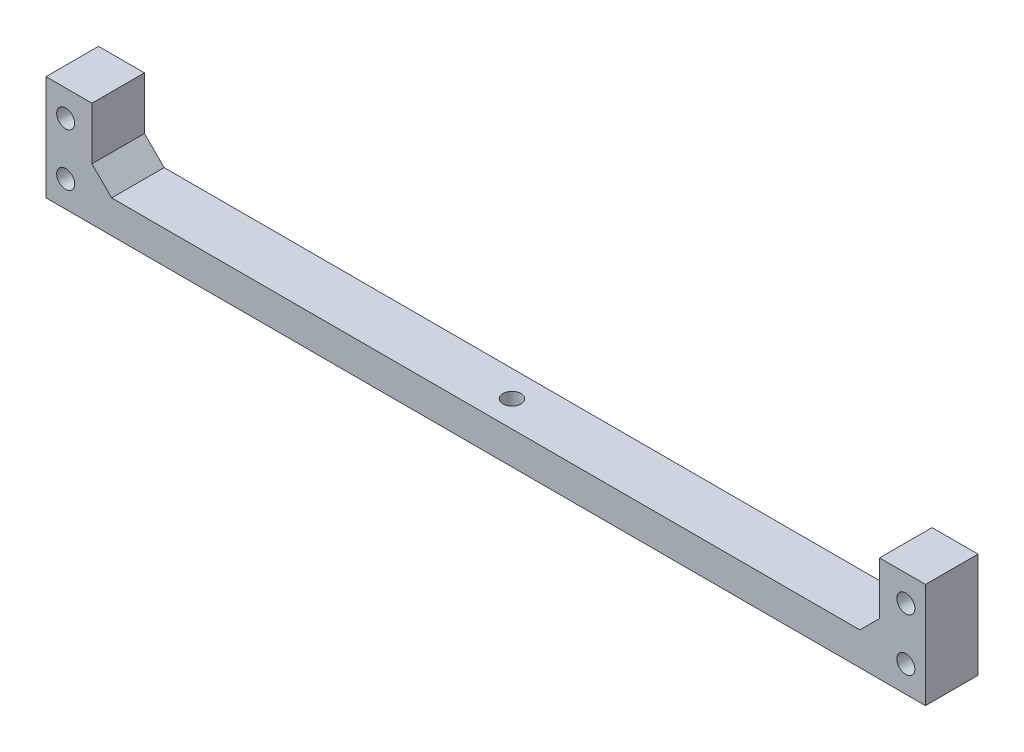
from build123d import *

# Parameters (mm, degrees)
SKETCH1_W               = 215.9
SKETCH1_H               = 12.7
BOSS_EXTRUDE1_DEPTH     = 6.35
CUT_EXTRUDE2_DEPTH      = 109.879819067
CUT_EXTRUDE2_DEPTH_BACK = 109.879819067
CUT_EXTRUDE3_DEPTH      = 110.433918417
CUT_EXTRUDE3_DEPTH_BACK = 110.433918417
SKETCH4_R               = 2.1828125
SKETCH5_W               = 12.7
SKETCH5_H               = 12.7
BOSS_EXTRUDE2_DEPTH     = 12.7
CUT_EXTRUDE1_DEPTH      = 111.351234701
CUT_EXTRUDE1_DEPTH_BACK = 111.351234701
SKETCH2_R               = 2.1828125
SKETCH2_W               = 1.5875
SKETCH2_H               = 25.4


with BuildPart() as part:
    # Sketch1 → Boss-Extrude1 (new, symmetric)
    with BuildSketch(Plane(origin=(0, 0, 0), x_dir=(1, 0, 0), z_dir=(0, 1, 0))):
        with Locations((0, 6.35)):
            Rectangle(SKETCH1_W, SKETCH1_H)
    extrude(amount=BOSS_EXTRUDE1_DEPTH, both=True)

    # Sketch3 → Cut-Extrude2 (cut, two sides: drawn at the far end of the back side and taken through both)
    with BuildSketch(Plane.XY.offset(-CUT_EXTRUDE2_DEPTH_BACK)):
        Polygon((-95.25, 6.35), (-90.4875, 1.5875), (90.4875, 1.5875), (95.25, 6.35), align=None)
    extrude(amount=CUT_EXTRUDE2_DEPTH + CUT_EXTRUDE2_DEPTH_BACK, mode=Mode.SUBTRACT)

    # Sketch4 → Cut-Extrude3 (cut, two sides: drawn at the far end of the back side and taken through both)
    with BuildSketch(Plane.XZ.offset(6.35).offset(-CUT_EXTRUDE3_DEPTH_BACK)):
        with Locations((0, -6.35)):
            Circle(SKETCH4_R)
    extrude(amount=CUT_EXTRUDE3_DEPTH + CUT_EXTRUDE3_DEPTH_BACK, mode=Mode.SUBTRACT)

    # Sketch5 → Boss-Extrude2 (add)
    with BuildSketch(Plane(origin=(0, 6.35, 0), x_dir=(1, 0, 0), z_dir=(0, 1, 0))):
        with Locations((-101.6, 6.35)):
            Rectangle(SKETCH5_W, SKETCH5_H)
        with Locations((101.6, 6.35)):
            Rectangle(SKETCH5_W, SKETCH5_H)
    extrude(amount=BOSS_EXTRUDE2_DEPTH)

    # Sketch2 → Cut-Extrude1 (cut, two sides: drawn at the far end of the back side and taken through both)
    with BuildSketch(Plane.XY.offset(-CUT_EXTRUDE1_DEPTH_BACK)):
        with Locations((-101.6, 0)):
            Circle(SKETCH2_R)
        with Locations((101.6, 0)):
            Circle(SKETCH2_R)
        with Locations((-101.6, 12.7)):
            Circle(SKETCH2_R)
        with Locations((101.6, 12.7)):
            Circle(SKETCH2_R)
        with Locations((107.15625, 6.35)):
            Rectangle(SKETCH2_W, SKETCH2_H)
        with Locations((-107.15625, 6.35)):
            Rectangle(SKETCH2_W, SKETCH2_H)
    extrude(amount=CUT_EXTRUDE1_DEPTH + CUT_EXTRUDE1_DEPTH_BACK, mode=Mode.SUBTRACT)


solid = part.part
